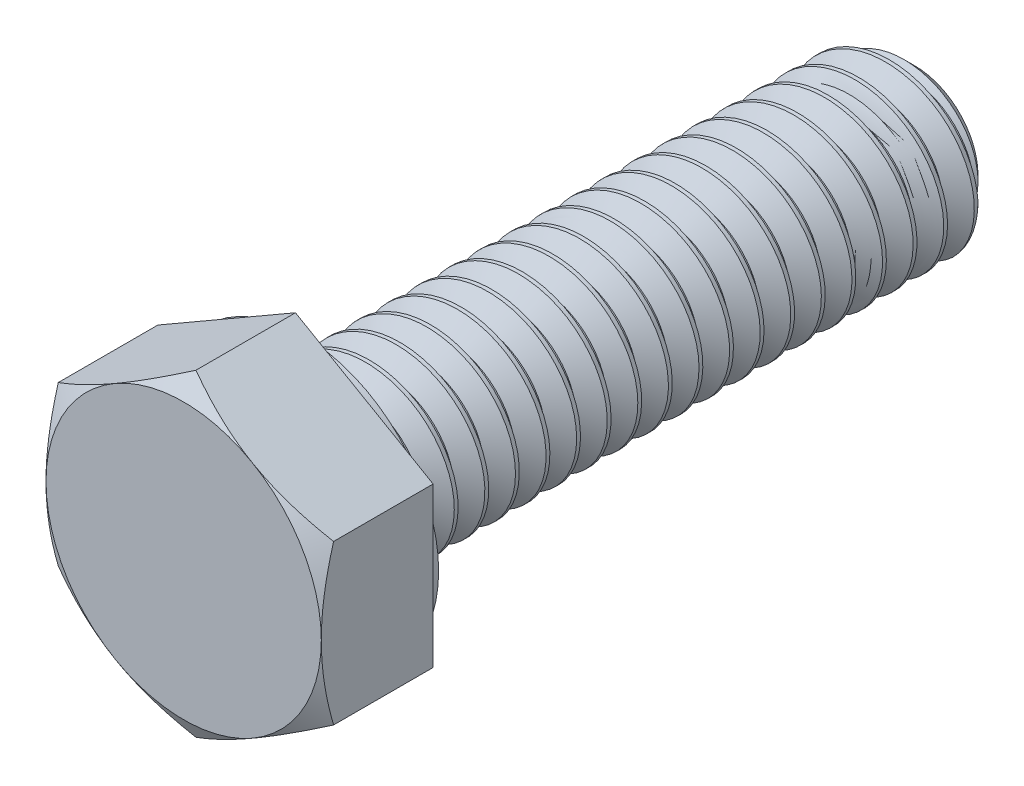
from build123d import *

# Parameters (mm, degrees)
SKETCH2_W           = 28.575
SKETCH2_H           = 3.96875
BOSS_EXTRUDE1_DEPTH = 5.159375
SKETCH7_R           = 6.2865
BOSS_EXTRUDE2_DEPTH = 0.3175
CHAMFER1_SIZE       = 1.058333333
SKETCH4_OUTSIDE_W   = 147.542
SKETCH4_OUTSIDE_H   = 149.506
SKETCH4_OUTSIDE_R   = 6.35
CUT_EXTRUDE1_DEPTH  = 36.101194994
CUT_EXTRUDE1_DRAFT  = -60
CUT_SWEEP1_PITCH    = 1.411111111
CUT_SWEEP1_TO       = 28.575
BOSS_EXTRUDE3_START = -0.3175
SKETCH8_R           = 6.2865
BOSS_EXTRUDE3_DEPTH = 0.3175


with BuildPart() as part:
    # Sketch2 → Revolve1 (revolve)
    with BuildSketch(Plane(origin=(0, 0, 0), x_dir=(0, 0, -1), z_dir=(1, 0, 0)), mode=Mode.PRIVATE) as revolve1_sk:
        with Locations((14.2875, 1.984375)):
            Rectangle(SKETCH2_W, SKETCH2_H)
    revolve(revolve1_sk.sketch.rotate(Axis((0, 0, 0), (0, 0, -1)), 90), axis=Axis((0, 0, 0), (0, 0, -1)))

    # Sketch3 → Boss-Extrude1 (add)
    with BuildSketch(Plane.XY):
        Polygon((0, 7.332348419), (-6.35, 3.666174209), (-6.35, -3.666174209), (0, -7.332348419), (6.35, -3.666174209), (6.35, 3.666174209), align=None)
    extrude(amount=BOSS_EXTRUDE1_DEPTH)

    # Sketch7 → Boss-Extrude2 (add)
    with BuildSketch(Plane(origin=(0, 0, 0), x_dir=(-1, 0, 0), z_dir=(0, 0, -1))):
        with Locations(Location((0, 0, 0), (0, 0, 180))):
            Circle(SKETCH7_R)
    extrude(amount=BOSS_EXTRUDE2_DEPTH)

    # Chamfer1
    chamfer1_edges = [part.edges().sort_by_distance(p)[0] for p in [
        (-3.96875, 0, -28.575),
    ]]
    chamfer(chamfer1_edges, length=CHAMFER1_SIZE)


with BuildPart() as cut_extrude1_tool:
    # Sketch4 outside → Cut-Extrude1 (with draft: the straight prism first)
    with BuildSketch(Plane.XY.offset(5.159375)):
        Rectangle(SKETCH4_OUTSIDE_W, SKETCH4_OUTSIDE_H)
        Circle(SKETCH4_OUTSIDE_R, mode=Mode.SUBTRACT)
    extrude(amount=-CUT_EXTRUDE1_DEPTH)
    # Cut-Extrude1: the draft: its side faces are tilted about the plane it starts from
    cut_extrude1_sides = [cut_extrude1_tool.faces().sort_by_distance(p)[0] for p in [
        (0, -74.753, -12.891222497),
        (73.771, 0, -12.891222497),
        (0, 74.753, -12.891222497),
        (-73.771, 0, -12.891222497),
        (-6.35, 0, -12.891222497),
    ]]
    draft(cut_extrude1_sides, Plane.XY.offset(5.159375), CUT_EXTRUDE1_DRAFT)


with BuildPart() as part_1:
    add(part.part)

    # Cut-Extrude1: cut by cut_extrude1_tool
    add(cut_extrude1_tool.part, mode=Mode.SUBTRACT)


with BuildPart() as body_2:
    # Split1: read off the stored shape, not the designer's step
    # Split1: the piece on the far side of the plane
    add(part_1.part)
    split(bisect_by=Plane.XY, keep=Keep.BOTTOM)

    # Cut-Sweep1: arcs per turn and ends read off the stored shape
    # Cut-Sweep1: the profile of Sketch5 screwed along a right-hand helix through 21.25 turns, 8 arcs to a turn; built about Z, then put on its axis
    cut_sweep1_z = Axis((0, 0, 0), (0, 0, 1))
    cut_sweep1_corners = [(4.045128629, 0, 0.044097222), (4.045128629, 0, -1.278819444), (3.052206448, 0, -0.705555556), (3.052206448, 0, -0.529166667)]
    with BuildLine(mode=Mode.PRIVATE) as cut_sweep1_profile:
        Line(cut_sweep1_corners[0], cut_sweep1_corners[1])
        Line(cut_sweep1_corners[1], cut_sweep1_corners[2])
        Line(cut_sweep1_corners[2], cut_sweep1_corners[3])
        Line(cut_sweep1_corners[3], cut_sweep1_corners[0])
    cut_sweep1_cap = Face(cut_sweep1_profile.wire())
    cut_sweep1_turn_angles = [0, 22.5, 45, 67.5, 90, 112.5, 135, 157.5, 180, 202.5, 225, 247.5, 270, 292.5, 315, 337.5, 360]
    cut_sweep1_turn_weights = [1, 0.9238795325112867, 1, 0.9238795325112867, 1, 0.9238795325112867, 1, 0.9238795325112867, 1, 0.9238795325112867, 1, 0.9238795325112867, 1, 0.9238795325112867, 1, 0.9238795325112867, 1]
    cut_sweep1_turn_rails = [Edge.make_bspline([Vector(p[0], p[1], 0).rotate(cut_sweep1_z, cut_sweep1_turn_angles[k]) / cut_sweep1_turn_weights[k] + Vector(0, 0, p[2] + CUT_SWEEP1_PITCH * cut_sweep1_turn_angles[k] / 360) for k in range(17)], [0, 0, 0, 1, 1, 2, 2, 3, 3, 4, 4, 5, 5, 6, 6, 7, 7, 8, 8, 8], 2, cut_sweep1_turn_weights) for p in cut_sweep1_corners]
    cut_sweep1_turn_sides = [Face.make_surface_from_curves(cut_sweep1_turn_rails[p[0]], cut_sweep1_turn_rails[p[1]]) for p in [(0, 1), (1, 2), (2, 3), (3, 0)]]
    cut_sweep1_last_angles = [7560, 7582.5, 7605, 7627.5, 7650]
    cut_sweep1_last_weights = [1, 0.9238795325112867, 1, 0.9238795325114234, 1]
    cut_sweep1_last_rails = [Edge.make_bspline([Vector(p[0], p[1], 0).rotate(cut_sweep1_z, cut_sweep1_last_angles[k]) / cut_sweep1_last_weights[k] + Vector(0, 0, p[2] + CUT_SWEEP1_PITCH * cut_sweep1_last_angles[k] / 360) for k in range(5)], [0, 0, 0, 1, 1, 2, 2, 2], 2, cut_sweep1_last_weights) for p in cut_sweep1_corners]
    cut_sweep1_last_sides = [Face.make_surface_from_curves(cut_sweep1_last_rails[p[0]], cut_sweep1_last_rails[p[1]]) for p in [(0, 1), (1, 2), (2, 3), (3, 0)]]
    cut_sweep1 = Plane(origin=(0, 0, -28.575), x_dir=(0, 1, 0), z_dir=(0, 0, 1)) * split(Solid(Shell([*[p.moved(Location((0, 0, CUT_SWEEP1_PITCH * i))) for i in range(21) for p in cut_sweep1_turn_sides], *cut_sweep1_last_sides, cut_sweep1_cap, cut_sweep1_cap.rotate(cut_sweep1_z, 7650).moved(Location((0, 0, CUT_SWEEP1_PITCH * 7650 / 360)))])), bisect_by=Plane.XY.offset(CUT_SWEEP1_TO), keep=Keep.BOTTOM, mode=Mode.PRIVATE)
    add(cut_sweep1, mode=Mode.SUBTRACT)


with BuildPart() as part_2:
    add(part_1.part)

    # Split1
    split(bisect_by=Plane.XY, keep=Keep.TOP)

    # Combine1: union body 2
    add(body_2.part)

    # Sketch8 → Boss-Extrude3 (add)
    with BuildSketch(Plane(origin=(0, 0, -0.3175), x_dir=(-1, 0, 0), z_dir=(0, 0, -1)).offset(BOSS_EXTRUDE3_START)):
        with Locations(Location((0, 0, 0), (0, 0, 180))):
            Circle(SKETCH8_R)
    extrude(amount=BOSS_EXTRUDE3_DEPTH)


solid = part_2.part
